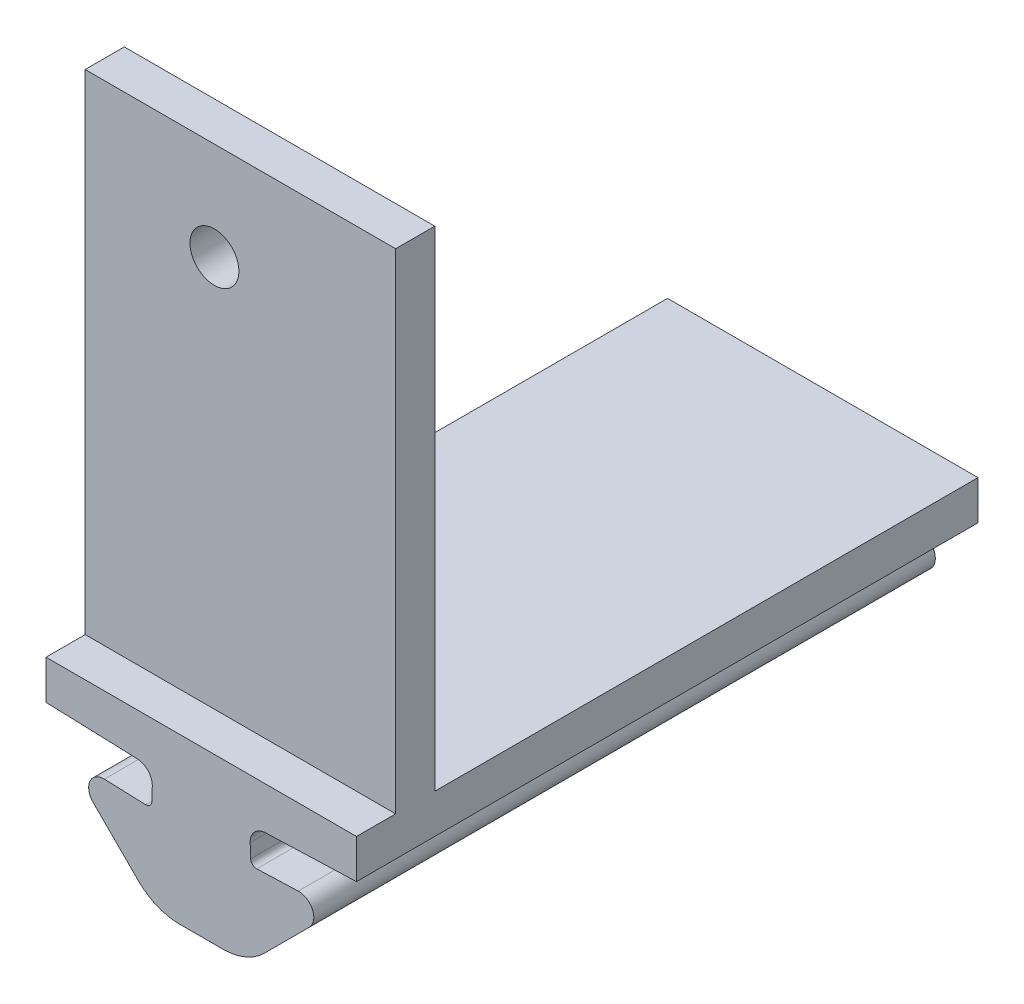
from build123d import *

# Parameters (mm, degrees)
BOSS_EXTRUDE1_DEPTH = 31.75
SKETCH19_W          = 15.860402013
SKETCH19_H          = 31.75
BOSS_EXTRUDE7_DEPTH = 2
SKETCH23_W          = 15.860402013
SKETCH23_H          = 2
BOSS_EXTRUDE8_DEPTH = 25
SKETCH24_R          = 1.25
CUT_EXTRUDE1_DEPTH  = 2.54


with BuildPart() as part:
    # Sketch2 → Boss-Extrude1 (new body)
    with BuildSketch(Plane.XY):
        with BuildLine():
            Line((-50.375618534, 45.609862895), (-50.351188886, 46.309436474))
            ThreePointArc((-50.351188886, 46.309436474), (-50.565618587, 46.88295476), (-51.12278195, 47.136868733))
            Line((-51.12278195, 47.136868733), (-55.780902554, 47.299533889))
            Line((-55.780902554, 47.299533889), (-47.850701548, 47.299533889))
            Line((-47.850701548, 47.299533889), (-47.850701548, 40.900752235))
            Line((-47.850701548, 40.900752235), (-48.952946324, 40.900752235))
            ThreePointArc((-48.952946324, 40.900752235), (-50.100996621, 41.129113637), (-51.074266668, 41.779431891))
            Line((-51.074266668, 41.779431891), (-53.375146928, 44.080312152))
            ThreePointArc((-53.375146928, 44.080312152), (-53.536830204, 44.931922499), (-52.803734096, 45.394471696))
            Line((-52.803734096, 45.394471696), (-50.685905631, 45.320515496))
            ThreePointArc((-50.685905631, 45.320515496), (-50.470836274, 45.400926634), (-50.375618534, 45.609862895))
        make_face()
    boss_extrude1 = extrude(amount=BOSS_EXTRUDE1_DEPTH)

    # Mirror2: Boss-Extrude1 across plane
    add(boss_extrude1.mirror(Plane(origin=(-47.850701548, 40.900752235, 31.75), x_dir=(0, 0, 1), z_dir=(-1, 0, 0))))

    # Sketch19 → Boss-Extrude7 (add)
    with BuildSketch(Plane(origin=(0, 47.299533889, 0), x_dir=(1, 0, 0), z_dir=(0, 1, 0))):
        with Locations((-47.850701548, -15.875)):
            Rectangle(SKETCH19_W, SKETCH19_H)
    extrude(amount=BOSS_EXTRUDE7_DEPTH)

    # Sketch23 → Boss-Extrude8 (add)
    with BuildSketch(Plane(origin=(0, 49.299533889, 0), x_dir=(1, 0, 0), z_dir=(0, 1, 0))):
        with Locations((-47.850701548, -28.75)):
            Rectangle(SKETCH23_W, SKETCH23_H)
    extrude(amount=BOSS_EXTRUDE8_DEPTH)

    # Sketch24 → Cut-Extrude1 (cut)
    with BuildSketch(Plane(origin=(0, 0, 27.75), x_dir=(-1, 0, 0), z_dir=(0, 0, -1))):
        with Locations((49.176902554, 69.299533889)):
            Circle(SKETCH24_R)
    extrude(amount=-CUT_EXTRUDE1_DEPTH, mode=Mode.SUBTRACT)


solid = part.part
